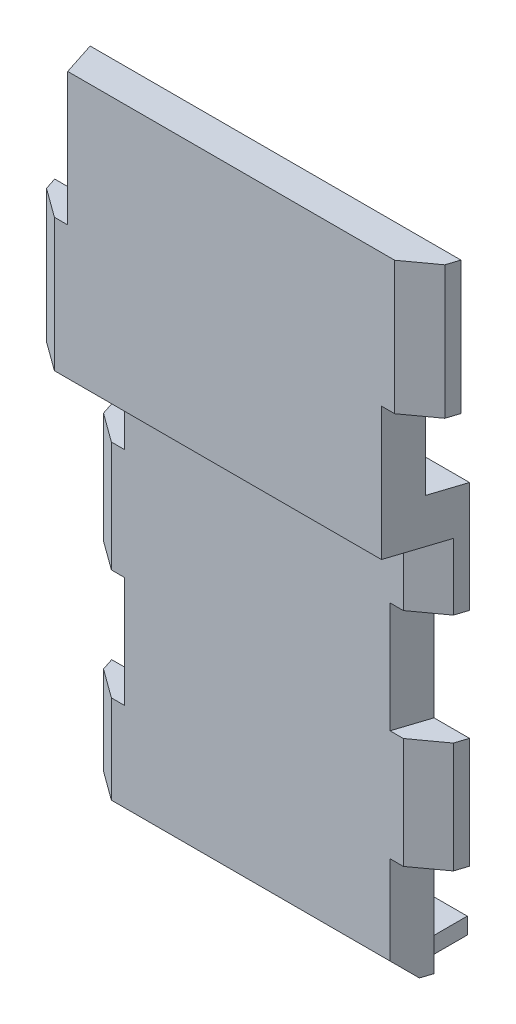
from build123d import *

# Parameters (mm, degrees)
BOSS_EXTRUDE1_DEPTH = 7.5
BOSS_EXTRUDE2_DEPTH = 7.5
DRAFT2_START        = -54.946043165
DRAFT2_DEPTH        = 100
DRAFT2_2_DEPTH      = 25
DRAFT2_START_2      = -29.946043165
DRAFT2_3_DEPTH      = 25
DRAFT2_START_3      = -4.946043165
DRAFT2_4_DEPTH      = 25
DRAFT2_START_4      = 20.053956835
DRAFT2_5_DEPTH      = 25
DRAFT2_START_5      = 35.053956835
DRAFT2_6_DEPTH      = 30
DRAFT2_START_6      = 65.053956835
DRAFT2_7_DEPTH      = 30
SKETCH3_W           = 64.747590887
SKETCH3_H           = 7.5
BOSS_EXTRUDE3_DEPTH = 7.5
CUT_EXTRUDE1_DEPTH  = 3.8
CUT_EXTRUDE2_DEPTH  = 3.8
LPATTERN1_COUNT     = 2
LPATTERN1_PITCH     = 25


# Read off the part's stored shape, not the designer's step: Draft2
with BuildPart() as part:
    # Sketch1 → Boss-Extrude1 (new body)
    with BuildSketch(Plane.XY):
        Polygon((-40.366906475, -54.946043165), (22.633093525, -54.946043165), (22.633093525, -29.946043165), (30.633093525, -29.946043165), (30.633093525, -4.946043165), (22.633093525, -4.946043165), (22.633093525, 20.053956835), (30.633093525, 20.053956835), (30.633093525, 45.053956835), (-32.366906475, 45.053956835), (-32.366906475, 20.053956835), (-40.366906475, 20.053956835), (-40.366906475, -4.946043165), (-32.366906475, -4.946043165), (-32.366906475, -29.946043165), (-40.366906475, -29.946043165), align=None)
    extrude(amount=BOSS_EXTRUDE1_DEPTH)

    # Sketch2 → Boss-Extrude2 (add)
    with BuildSketch(Plane.XY.offset(7.5)):
        Polygon((-48.166906475, 35.053956835), (30.633093525, 35.053956835), (30.633093525, 65.053956835), (38.633093525, 65.053956835), (38.633093525, 95.053956835), (-40.166906475, 95.053956835), (-40.166906475, 65.053956835), (-48.166906475, 65.053956835), align=None)
    extrude(amount=BOSS_EXTRUDE2_DEPTH)

    # Draft2 outline → Draft2 (add)
    with BuildSketch(Plane(origin=(0, 0, 0), x_dir=(1, 0, 0), z_dir=(0, 1, 0)).offset(DRAFT2_START)):
        Polygon((-32.366906475, 0), (-37.240701918, 0), (-34.803804197, -7.5), (-32.366906475, -7.5), align=None)
        Polygon((27.506888969, 0), (22.633093525, 0), (22.633093525, -7.5), (25.069991247, -7.5), align=None)
    extrude(amount=DRAFT2_DEPTH)

    # Draft2 2 outline → Draft2 2 (add)
    with BuildSketch(Plane(origin=(0, 0, 0), x_dir=(1, 0, 0), z_dir=(0, 1, 0)).offset(DRAFT2_START)):
        Polygon((-40.366906475, 0), (-45.240701918, 0), (-42.803804197, -7.5), (-40.366906475, -7.5), align=None)
    extrude(amount=DRAFT2_2_DEPTH)

    # Draft2 3 outline → Draft2 3 (add)
    with BuildSketch(Plane(origin=(0, 0, 0), x_dir=(1, 0, 0), z_dir=(0, 1, 0)).offset(DRAFT2_START_2)):
        Polygon((35.506888969, 0), (30.633093525, 0), (30.633093525, -7.5), (33.069991247, -7.5), align=None)
    extrude(amount=DRAFT2_3_DEPTH)

    # Draft2 4 outline → Draft2 4 (add)
    with BuildSketch(Plane(origin=(0, 0, 0), x_dir=(1, 0, 0), z_dir=(0, 1, 0)).offset(DRAFT2_START_3)):
        Polygon((-40.366906475, 0), (-45.240701918, 0), (-42.803804197, -7.5), (-40.366906475, -7.5), align=None)
    extrude(amount=DRAFT2_4_DEPTH)

    # Draft2 5 outline → Draft2 5 (add)
    with BuildSketch(Plane(origin=(0, 0, 0), x_dir=(1, 0, 0), z_dir=(0, 1, 0)).offset(DRAFT2_START_4)):
        Polygon((35.506888969, 0), (30.633093525, 0), (30.633093525, -7.5), (33.069991247, -7.5), align=None)
    extrude(amount=DRAFT2_5_DEPTH)

    # Draft2 6 outline → Draft2 6 (add)
    with BuildSketch(Plane(origin=(0, 0, 0), x_dir=(1, 0, 0), z_dir=(0, 1, 0)).offset(DRAFT2_START_5)):
        Polygon((-48.166906475, -15), (-48.166906475, -7.5), (-50.603804197, -7.5), align=None)
        Polygon((33.069991247, -7.5), (30.633093525, -7.5), (30.633093525, -15), align=None)
    extrude(amount=DRAFT2_6_DEPTH)

    # Draft2 7 outline → Draft2 7 (add)
    with BuildSketch(Plane(origin=(0, 0, 0), x_dir=(1, 0, 0), z_dir=(0, 1, 0)).offset(DRAFT2_START_6)):
        Polygon((41.069991247, -7.5), (38.633093525, -7.5), (38.633093525, -15), align=None)
        Polygon((-40.166906475, -7.5), (-42.603804197, -7.5), (-40.166906475, -15), align=None)
    extrude(amount=DRAFT2_7_DEPTH)

    # Sketch3 → Boss-Extrude3 (add)
    with BuildSketch(Plane(origin=(0, 0, 0), x_dir=(-1, 0, 0), z_dir=(0, 0, -1))):
        with Locations((4.866906474, -51.196043165)):
            Rectangle(SKETCH3_W, SKETCH3_H)
    boss_extrude3 = extrude(amount=BOSS_EXTRUDE3_DEPTH)

    # Sketch4 → Cut-Extrude1 (cut)
    with BuildSketch(Plane.XZ.offset(54.946043165)):
        Polygon((27.506888969, -7.5), (27.506888969, 0), (20.278859445, -2.348529157), (20.278859445, -7.5), align=None)
    cut_extrude1 = extrude(amount=-CUT_EXTRUDE1_DEPTH, mode=Mode.SUBTRACT)

    # Sketch5 → Cut-Extrude2 (cut)
    with BuildSketch(Plane(origin=(0, -47.446043165, 0), x_dir=(1, 0, 0), z_dir=(0, 1, 0))):
        Polygon((-37.240701918, 7.5), (-37.240701918, 0), (-30.012672394, 2.348529157), (-30.012672394, 7.5), align=None)
    cut_extrude2 = extrude(amount=-CUT_EXTRUDE2_DEPTH, mode=Mode.SUBTRACT)

    # LPattern1: Boss-Extrude3, Cut-Extrude1, Cut-Extrude2 ×2
    with Locations(*[(0, i * LPATTERN1_PITCH, 0) for i in range(1, LPATTERN1_COUNT)]):
        add(boss_extrude3)
        add(cut_extrude1, mode=Mode.SUBTRACT)
        add(cut_extrude2, mode=Mode.SUBTRACT)

    # Chamfer2
    # the kernel refuses this chamfer: 5 mm, written as the material it takes off along each edge
    with BuildSketch(Plane(origin=(-40.441261641, -51.612709832, 4.248239139), x_dir=(-0.7189342036162105, 0.6942471081166146, 0.033978872000742164), z_dir=(-0.4932114534551065, -0.5439749702030539, 0.6788473274406317))) as chamfer2_piece_1:
        Polygon((-3.286728939, 2.231187156), (3.915317626, 2.231187156), (-0.628588687, -4.462374312), align=None)
    extrude(amount=5.70452533, mode=Mode.SUBTRACT)
    with BuildSketch(Plane(origin=(33.069991247, -42.853897845, 7.5), x_dir=(-0.9997407638607628, 0, 0.022768510603425433), z_dir=(0, 1, 0))) as chamfer2_piece_2:
        with BuildLine():
            Line((5.163141872, 0), (-1.817393185, -4.83271311))
            Line((-1.817393185, -4.83271311), (-1.911770596, -4.799654007))
            ThreePointArc((-1.911770596, -4.799654007), (-0.947600353, -2.402729105), (-0.094377411, 0.033059103))
            Line((-0.094377411, 0.033059103), (0.002276851, 0.099974076))
            ThreePointArc((0.002276851, 0.099974076), (2.582509488, 0.041210789), (5.165418723, 0.099974076))
            Line((5.165418723, 0.099974076), (5.163141872, 0))
        make_face()
    extrude(amount=50.815709359, mode=Mode.SUBTRACT)
    with BuildSketch(Plane(origin=(-49.214170654, -54.946043165, -12.229079318), x_dir=(0.9506969379377622, -0.027495876610586285, -0.30890016018962835), z_dir=(0.309016994289291, 0, 0.951056516322985))) as chamfer2_piece_3:
        with BuildLine():
            Line((5.143365976, 0), (-0.282735774, 5.135588968))
            Line((-0.282735774, 5.135588968), (-0.382697966, 5.13283938))
            ThreePointArc((-0.382697966, 5.13283938), (-0.170646135, 2.566989148), (-0.099962192, -0.002749588))
            Line((-0.099962192, -0.002749588), (0.002749588, -0.099962192))
            ThreePointArc((0.002749588, -0.099962192), (2.572488324, -0.029278248), (5.146115564, -0.099962192))
            Line((5.146115564, -0.099962192), (5.143365976, 0))
        make_face()
    extrude(amount=33.602796561, mode=Mode.SUBTRACT)
    with BuildSketch(Plane(origin=(33.069991247, 7.146102155, 7.5), x_dir=(-0.9997407638607628, 0, 0.022768510603425433), z_dir=(0, 1, 0))) as chamfer2_piece_4:
        with BuildLine():
            Line((5.163141872, 0), (-1.817393185, -4.83271311))
            Line((-1.817393185, -4.83271311), (-1.911770596, -4.799654007))
            ThreePointArc((-1.911770596, -4.799654007), (-0.947600353, -2.402729105), (-0.094377411, 0.033059103))
            Line((-0.094377411, 0.033059103), (0.002276851, 0.099974076))
            ThreePointArc((0.002276851, 0.099974076), (2.582509488, 0.041210789), (5.165418723, 0.099974076))
            Line((5.165418723, 0.099974076), (5.163141872, 0))
        make_face()
    extrude(amount=27.90785468, mode=Mode.SUBTRACT)
    with BuildSketch(Plane(origin=(-42.803804197, -67.853897845, 7.5), x_dir=(0.9997407638607191, 0, 0.022768510605345404), z_dir=(0, 1, 0)), Plane(origin=(-42.803804197, -17.853897845, 7.5), x_dir=(0.9997407638607191, 0, 0.022768510605345404), z_dir=(0, 1, 0))) as chamfer2_piece_5:
        with BuildLine():
            Line((5.163141872, 0), (-1.817393184, 4.83271311))
            Line((-1.817393184, 4.83271311), (-1.911770595, 4.799654007))
            ThreePointArc((-1.911770595, 4.799654007), (-0.947600353, 2.402729105), (-0.094377411, -0.033059103))
            Line((-0.094377411, -0.033059103), (0.002276851, -0.099974076))
            ThreePointArc((0.002276851, -0.099974076), (2.582509488, -0.041210789), (5.165418723, -0.099974076))
            Line((5.165418723, -0.099974076), (5.163141872, 0))
        make_face()
    extrude(amount=50.815709359, mode=Mode.SUBTRACT)
    with BuildSketch(Plane(origin=(-48.166906475, 77.961811514, 15), x_dir=(0.9997407638607629, 0, 0.022768510603425628), z_dir=(0, -1, 0)), Plane(origin=(38.633093525, 52.146102155, 15), x_dir=(-0.9997407638607629, 0, 0.022768510603425628), z_dir=(0, 1, 0))) as chamfer2_piece_6:
        with BuildLine():
            Line((5.163141872, 0), (-1.817393185, -4.83271311))
            Line((-1.817393185, -4.83271311), (-1.911770596, -4.799654007))
            ThreePointArc((-1.911770596, -4.799654007), (-0.947600353, -2.402729105), (-0.094377411, 0.033059103))
            Line((-0.094377411, 0.033059103), (0.002276851, 0.099974076))
            ThreePointArc((0.002276851, 0.099974076), (2.582509488, 0.041210789), (5.165418723, 0.099974076))
            Line((5.165418723, 0.099974076), (5.163141872, 0))
        make_face()
    extrude(amount=55.815709359, mode=Mode.SUBTRACT)
    with BuildSketch(Plane(origin=(-32.366906475, -54.946043165, 7.5), x_dir=(0, -0.027495876610586317, -0.9996219169112968), z_dir=(1, 0, 0))) as chamfer2_piece_7:
        with BuildLine():
            Line((5.143365976, 0), (-0.282735774, 5.135588968))
            Line((-0.282735774, 5.135588968), (-0.382697966, 5.13283938))
            ThreePointArc((-0.382697966, 5.13283938), (-0.170646135, 2.566989148), (-0.099962192, -0.002749588))
            Line((-0.099962192, -0.002749588), (0.002749588, -0.099962192))
            ThreePointArc((0.002749588, -0.099962192), (2.572488324, -0.029278248), (5.146115564, -0.099962192))
            Line((5.146115564, -0.099962192), (5.143365976, 0))
        make_face()
    extrude(amount=55, mode=Mode.SUBTRACT)
    with BuildSketch(Plane(origin=(-34.803804197, -54.946043165, 7.5), x_dir=(0, -0.02749587670275982, -0.9996219169087613), z_dir=(1, 0, 0))) as chamfer2_piece_8:
        with BuildLine():
            Line((5.143365976, 0), (-0.282735775, 5.135588968))
            Line((-0.282735775, 5.135588968), (-0.382697967, 5.13283938))
            ThreePointArc((-0.382697967, 5.13283938), (-0.170646136, 2.566989148), (-0.099962192, -0.002749588))
            Line((-0.099962192, -0.002749588), (0.002749588, -0.099962192))
            ThreePointArc((0.002749588, -0.099962192), (2.572488324, -0.029278248), (5.146115564, -0.099962192))
            Line((5.146115564, -0.099962192), (5.143365976, 0))
        make_face()
    extrude(amount=2.436897722, mode=Mode.SUBTRACT)
    with BuildSketch(Plane(origin=(22.633093525, -54.946043165, 7.5), x_dir=(0, -0.02749587670275982, -0.9996219169087613), z_dir=(1, 0, 0))) as chamfer2_piece_9:
        with BuildLine():
            Line((5.143365976, 0), (-0.282735775, 5.135588968))
            Line((-0.282735775, 5.135588968), (-0.382697967, 5.13283938))
            ThreePointArc((-0.382697967, 5.13283938), (-0.170646136, 2.566989148), (-0.099962192, -0.002749588))
            Line((-0.099962192, -0.002749588), (0.002749588, -0.099962192))
            ThreePointArc((0.002749588, -0.099962192), (2.572488324, -0.029278248), (5.146115564, -0.099962192))
            Line((5.146115564, -0.099962192), (5.143365976, 0))
        make_face()
    extrude(amount=15.295312662, mode=Mode.SUBTRACT)
    with BuildSketch(Plane(origin=(-40.366906475, -54.946043165, 7.5), x_dir=(0, -0.027495876610586317, -0.9996219169112968), z_dir=(1, 0, 0))) as chamfer2_piece_10:
        with BuildLine():
            Line((5.143365976, 0), (-0.282735774, 5.135588968))
            Line((-0.282735774, 5.135588968), (-0.382697966, 5.13283938))
            ThreePointArc((-0.382697966, 5.13283938), (-0.170646135, 2.566989148), (-0.099962192, -0.002749588))
            Line((-0.099962192, -0.002749588), (0.002749588, -0.099962192))
            ThreePointArc((0.002749588, -0.099962192), (2.572488324, -0.029278248), (5.146115564, -0.099962192))
            Line((5.146115564, -0.099962192), (5.143365976, 0))
        make_face()
    extrude(amount=5.563102278, mode=Mode.SUBTRACT)
    with BuildSketch(Plane(origin=(-55.662219137, -54.946043165, 7.5), x_dir=(0, -0.027495876610586317, -0.9996219169112968), z_dir=(1, 0, 0))) as chamfer2_piece_11:
        with BuildLine():
            Line((5.143365976, 0), (-0.282735774, 5.135588968))
            Line((-0.282735774, 5.135588968), (-0.382697966, 5.13283938))
            ThreePointArc((-0.382697966, 5.13283938), (-0.170646135, 2.566989148), (-0.099962192, -0.002749588))
            Line((-0.099962192, -0.002749588), (0.002749588, -0.099962192))
            ThreePointArc((0.002749588, -0.099962192), (2.572488324, -0.029278248), (5.146115564, -0.099962192))
            Line((5.146115564, -0.099962192), (5.143365976, 0))
        make_face()
    extrude(amount=15.295312662, mode=Mode.SUBTRACT)


solid = part.part
